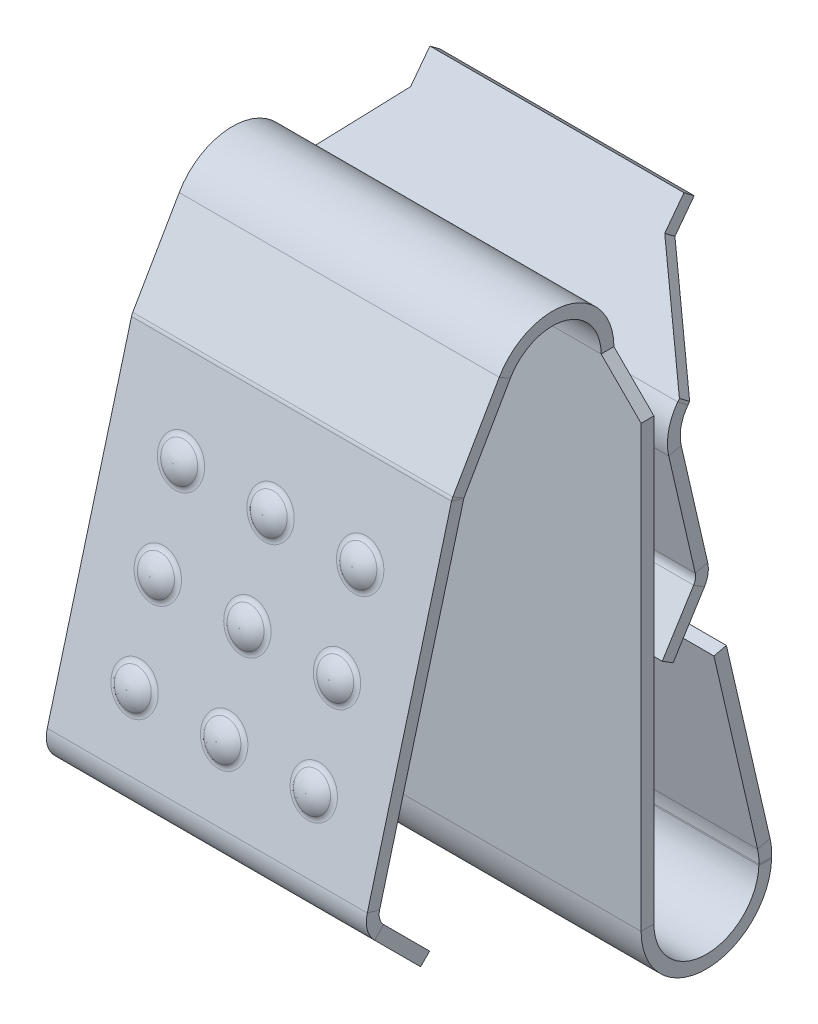
from build123d import *

# Parameters (mm, degrees)
SKETCH7_W              = 7.9375
SKETCH7_H              = 9.524915418
BASE_FLANGE1_DEPTH     = 0.254
EDGE_FLANGE1_DEPTH     = 6.35
CHAMFER1_SIZE          = 0.79375
EDGE_FLANGE2_START     = -3.175
EDGE_FLANGE2_DEPTH     = 6.35
EDGE_FLANGE3_DEPTH     = 6.35
CHAMFER2_SIZE          = 0.762
EDGE_FLANGE4_DEPTH     = 7.9375
EDGE_FLANGE5_DEPTH     = 7.9375
EDGE_FLANGE6_START     = -3.96875
EDGE_FLANGE6_DEPTH     = 7.9375
CHAMFER3_SIZE          = 1.4478
CHAMFER3_SIZE2         = 1.921295493
SKETCH30_W             = 5.0419
SKETCH30_H             = 0.635
TAB1_DEPTH             = 0.254
SKETCH33_W             = 1.651
SKETCH33_H             = 1.650807976
CUT_EXTRUDE1_DEPTH     = 0.254
EDGE_FLANGE7_DEPTH     = 1.524
SKETCH37_R             = 0.3937
BOSS_EXTRUDE1_DEPTH    = 0.166878
FILLET1_R              = 0.530606
FILLET2_R              = 0.1524
LPATTERN1_COUNT        = 3
LPATTERN1_PITCH        = 1.778
LPATTERN1_COUNT_DIR2   = 3
LPATTERN1_PITCH_DIR2   = 1.778
FILLET1_OF_LPATTERN1_R = 0.530606
FILLET2_OF_LPATTERN1_R = 0.1524


# Read off the part's stored shape, not the designer's step: Edge-Flange2, Edge-Flange6, SurfaceCut1
# Sheet-metal steps are written as plain solids
# Some blends are built 0.0001 mm under size
with BuildPart() as part:
    # Sketch7 → Base-Flange1 (new body)
    with BuildSketch(Plane.XY):
        with Locations((0, 4.762457709)):
            Rectangle(SKETCH7_W, SKETCH7_H)
    extrude(amount=-BASE_FLANGE1_DEPTH)

    # Edge-Flange1 section (across the edge) → Edge-Flange1 (add)
    with BuildSketch(Plane(origin=(3.175, 13.127090857, 0), x_dir=(0, -0.500000000000001, -0.866025403784438), z_dir=(-1, 0, 0))):
        with BuildLine():
            Line((-0.254, 3.602175439), (-0.254, 5.444797135))
            Line((-0.254, 5.444797135), (0, 5.444797135))
            Line((0, 5.444797135), (0, 3.602175439))
            ThreePointArc((0, 3.602175439), (0.715387858, 2.669863832), (1.80108772, 3.119575439))
            Line((1.80108772, 3.119575439), (2.021058172, 2.992575439))
            ThreePointArc((2.021058172, 2.992575439), (0.64964782, 2.424518672), (-0.254, 3.602175439))
        make_face()
    extrude(amount=EDGE_FLANGE1_DEPTH)

    # Chamfer1
    chamfer1_edges = [part.edges().sort_by_distance(p)[0] for p in [
        (-3.96875, 9.524915418, -0.127),
        (3.96875, 9.524915418, -0.127),
    ]]
    chamfer(chamfer1_edges, length=CHAMFER1_SIZE - 0.0001)  # a hair under: the kernel refuses the full size

    # Edge-Flange2 outline → Edge-Flange2 (add)
    with BuildSketch(Plane.YZ.offset(EDGE_FLANGE2_START)):
        with BuildLine():
            Line((8.41175822, 2.722398567), (8.53875822, 2.94236902))
            ThreePointArc((8.53875822, 2.94236902), (8.508959812, 2.957063969), (8.477498258, 2.967743727))
            Line((8.477498258, 2.967743727), (2.238776274, 4.639404245))
            Line((2.238776274, 4.639404245), (2.173036237, 4.394059085))
            Line((2.173036237, 4.394059085), (8.41175822, 2.722398567))
        make_face()
    extrude(amount=EDGE_FLANGE2_DEPTH)

    # Edge-Flange3 section (across the edge) → Edge-Flange3 (add)
    with BuildSketch(Plane(origin=(3.175, 2.003056124, 4.439605119), x_dir=(0, 0.7071067811865389, -0.7071067811865563), z_dir=(-1, 0, 0))):
        with BuildLine():
            Line((-0.254, 0.175976362), (-0.254, 2.229269032))
            Line((-0.254, 2.229269032), (0, 2.229269032))
            Line((0, 2.229269032), (0, 0.175976362))
            ThreePointArc((0, 0.175976362), (0.040835457, 0.023576362), (0.1524, -0.087988181))
            Line((0.1524, -0.087988181), (0.0254, -0.307958634))
            ThreePointArc((0.0254, -0.307958634), (-0.179134996, -0.103423638), (-0.254, 0.175976362))
        make_face()
    extrude(amount=EDGE_FLANGE3_DEPTH)

    # Chamfer2
    chamfer2_edges = [part.edges().sort_by_distance(p)[0] for p in [
        (3.175, 0.336922313, 2.953076431),
        (-3.175, 0.336922313, 2.953076431),
    ]]
    chamfer(chamfer2_edges, length=CHAMFER2_SIZE)

    # Edge-Flange4 section (across the edge) → Edge-Flange4 (add)
    with BuildSketch(Plane(origin=(3.96875, -59.661766042, -0.254), x_dir=(0, 0.03489949670250102, 0.9993908270190958), z_dir=(-1, 0, 0))):
        with BuildLine():
            Line((-0.254, 59.661766042), (-0.254, 59.687166042))
            Line((-0.254, 59.687166042), (0, 59.687166042))
            Line((0, 59.687166042), (0, 59.661766042))
            ThreePointArc((0, 59.661766042), (1.023225064, 58.620524653), (2.082165607, 59.625421706))
            Line((2.082165607, 59.625421706), (2.336010877, 59.616557234))
            ThreePointArc((2.336010877, 59.616557234), (1.018792153, 58.366563338), (-0.254, 59.661766042))
        make_face()
    extrude(amount=EDGE_FLANGE4_DEPTH)

    # Edge-Flange5 section (across the edge) → Edge-Flange5 (add)
    with BuildSketch(Plane(origin=(3.96875, 0.126059583, -2.341836877), x_dir=(0, -0.2249510543438583, 0.9743700647852369), z_dir=(-1, 0, 0))):
        with BuildLine():
            Line((-0.254, 0.137102911), (-0.254, 7.973148266))
            Line((-0.254, 7.973148266), (0, 7.973148266))
            Line((0, 7.973148266), (0, 0.137102911))
            ThreePointArc((0, 0.137102911), (0.008909321, 0.001172934), (0.035484845, -0.132431243))
            Line((0.035484845, -0.132431243), (-0.209860315, -0.19817128))
            ThreePointArc((-0.209860315, -0.19817128), (-0.242917673, -0.031980718), (-0.254, 0.137102911))
        make_face()
    extrude(amount=EDGE_FLANGE5_DEPTH)

    # Edge-Flange6 outline → Edge-Flange6 (add)
    with BuildSketch(Plane.YZ.offset(EDGE_FLANGE6_START)):
        with BuildLine():
            Line((10.313206583, -1.916191386), (8.73485091, -0.726815076))
            ThreePointArc((8.73485091, -0.726815076), (8.334645124, -0.544430792), (7.894856575, -0.548268768))
            Line((7.894856575, -0.548268768), (7.951994143, -0.795758765))
            ThreePointArc((7.951994143, -0.795758765), (8.281835555, -0.792880282), (8.581989894, -0.929668495))
            Line((8.581989894, -0.929668495), (10.160345567, -2.119044805))
            Line((10.160345567, -2.119044805), (10.313206583, -1.916191386))
        make_face()
    extrude(amount=EDGE_FLANGE6_DEPTH)

    # Chamfer3
    chamfer3_edges = [part.edges().sort_by_distance(p)[0] for p in [
        (-3.96875, 10.236776075, -2.017618096),
        (3.96875, 10.236776075, -2.017618096),
    ]]
    chamfer3_side = [part.faces().sort_by_distance(p)[0] for p in [
        (0, 10.236776075, -2.017618096),
    ]]
    chamfer(chamfer3_edges, length=CHAMFER3_SIZE, length2=CHAMFER3_SIZE2, reference=chamfer3_side[0])

    # Sketch30 → Tab1 (add)
    with BuildSketch(Plane(origin=(0, 2.814270104, 3.734662569), x_dir=(1, 0, 0), z_dir=(0, 0.6018150231520505, 0.7986355100472912))):
        with Locations((0, 9.707185762)):
            Rectangle(SKETCH30_W, SKETCH30_H)
    extrude(amount=-TAB1_DEPTH)

    # Sketch33 → Cut-Extrude1 (cut)
    with BuildSketch(Plane(origin=(0, 0.576813417, -2.498453398), x_dir=(-1, 0, 0), z_dir=(0, 0.2249510543438583, -0.9743700647852369))):
        with Locations((-3.14325, 4.408673174)):
            Rectangle(SKETCH33_W, SKETCH33_H)
    cut_extrude1 = extrude(amount=-CUT_EXTRUDE1_DEPTH, mode=Mode.SUBTRACT)

    # Edge-Flange7 section (across the edge) → Edge-Flange7 (add)
    with BuildSketch(Plane(origin=(2.44475, 5.517090239, -1.097219381), x_dir=(-1.6147430075010574e-15, 0.5299192642332057, 0.8480480961564255), z_dir=(1, 0, 0))):
        with BuildLine():
            Line((-0.254, 0.105210245), (-0.254, 1.279089755))
            Line((-0.254, 1.279089755), (0, 1.279089755))
            Line((0, 1.279089755), (0, 0.105210245))
            ThreePointArc((0, 0.105210245), (0.019334599, 0.008008653), (0.074394878, -0.074394878))
            Line((0.074394878, -0.074394878), (-0.105210245, -0.254))
            ThreePointArc((-0.105210245, -0.254), (-0.215330803, -0.089192939), (-0.254, 0.105210245))
        make_face()
    edge_flange7 = extrude(amount=EDGE_FLANGE7_DEPTH)

    # Mirror1: Cut-Extrude1, Edge-Flange7 across plane
    add(cut_extrude1.mirror(Plane(origin=(0, 0, 0), x_dir=(0, 0, 1), z_dir=(1, 0, 0))), mode=Mode.SUBTRACT)
    add(edge_flange7.mirror(Plane(origin=(0, 0, 0), x_dir=(0, 0, 1), z_dir=(1, 0, 0))))

    # Sketch37 → Boss-Extrude1 (add)
    with BuildSketch(Plane(origin=(0, 1.309820635, 4.888317158), x_dir=(1, 0, 0), z_dir=(0, 0.2588190451025286, 0.9659258262890663))):
        with Locations(Location((-1.77165, 5.790807795, 0), (0, 0, 90))):
            Circle(SKETCH37_R)
    boss_extrude1 = extrude(amount=BOSS_EXTRUDE1_DEPTH)

    # Fillet1
    # the kernel refuses this fillet: 0.530606 mm, written as the material it takes off along each edge
    with BuildSketch(Plane(origin=(-1.77165, 6.946502644, 3.550737584), x_dir=(0, 0.9659258262890662, -0.2588190451025287), z_dir=(1, 0, 0))) as fillet1_piece_1:
        with BuildLine():
            CenterArc((0.007378024, -0.530606), FILLET1_R, 43.274584136, 46.725415864)
            Line((0.007378024, 0), (0.007378024, 0.01061212))
            Line((0.007378024, 0.01061212), (0.3937, 0.01061212))
            Line((0.3937, 0.01061212), (0.40431212, 0))
            ThreePointArc((0.40431212, 0), (0.40431212, -0.083439), (0.40142644, -0.15960344))
            Line((0.40142644, -0.15960344), (0.3937, -0.166878))
        make_face()
    revolve(axis=Axis((-1.77165, 6.946502644, 3.550737584), (0, 0.2588190451025286, 0.9659258262890663)), mode=Mode.SUBTRACT)

    # Fillet2
    fillet2_edges = [part.edges().sort_by_distance(p)[0] for p in [
        (-1.77165, 6.523026441, 3.491442872),
    ]]
    fillet(fillet2_edges, radius=FILLET2_R)

    # SurfaceCut1 outline → SurfaceCut1 (revolve, cut)
    with BuildSketch(Plane(origin=(-1.77165, 5.593490804, -1.498771344), x_dir=(1, 0, 0), z_dir=(0, -0.9659258262890661, 0.25881904510252907))):
        with BuildLine():
            Line((0, 4.806758316), (0.454713562, 4.806758316))
            ThreePointArc((0.454713562, 4.806758316), (0.312668551, 4.832390441), (0.188541431, 4.906053519))
            ThreePointArc((0.188541431, 4.906053519), (0.10405741, 4.956190451), (0.007378024, 4.973636316))
            Line((0.007378024, 4.973636316), (0, 4.973636316))
            Line((0, 4.973636316), (0, 4.806758316))
        make_face()
    surfacecut1 = revolve(axis=Axis((-1.77165, 5.593490804, -1.498771344), (0, 0.25881904510252907, 0.9659258262890661)), mode=Mode.SUBTRACT)

    # LPattern1: Boss-Extrude1, SurfaceCut1 3 × 3
    with Locations(*[Vector(1, 0, 0) * (i * LPATTERN1_PITCH) + Vector(0, -0.9659258262890662, 0.25881904510252857) * (j * LPATTERN1_PITCH_DIR2) for i in range(LPATTERN1_COUNT) for j in range(LPATTERN1_COUNT_DIR2) if (i, j) != (0, 0)]):
        add(boss_extrude1)
        add(surfacecut1, mode=Mode.SUBTRACT)

    # Fillet1 of LPattern1
    # the kernel refuses this fillet: 0.530606 mm, written as the material it takes off along each edge
    with BuildSketch(Plane(origin=(-1.77165, 5.229086525, 4.010917846), x_dir=(0, 0.9659258262890665, -0.25881904510252707), z_dir=(1, 0, 0))) as fillet1_of_lpattern1_piece_1:
        with BuildLine():
            CenterArc((0.007378024, -0.530606), FILLET1_OF_LPATTERN1_R, 43.274584136, 46.725415864)
            Line((0.007378024, 0), (0.007378024, 0.01061212))
            Line((0.007378024, 0.01061212), (0.3937, 0.01061212))
            Line((0.3937, 0.01061212), (0.40431212, 0))
            ThreePointArc((0.40431212, 0), (0.40431212, -0.083439), (0.40142644, -0.15960344))
            Line((0.40142644, -0.15960344), (0.3937, -0.166878))
        make_face()
    revolve(axis=Axis((-1.77165, 5.229086525, 4.010917846), (0, 0.2588190451025286, 0.9659258262890663)), mode=Mode.SUBTRACT)
    with BuildSketch(Plane(origin=(-1.77165, 3.511670405, 4.471098109), x_dir=(0, 0.9659258262890665, -0.2588190451025276), z_dir=(1, 0, 0))) as fillet1_of_lpattern1_piece_2:
        with BuildLine():
            CenterArc((0.007378024, -0.530606), FILLET1_OF_LPATTERN1_R, 43.274584136, 46.725415864)
            Line((0.007378024, 0), (0.007378024, 0.01061212))
            Line((0.007378024, 0.01061212), (0.3937, 0.01061212))
            Line((0.3937, 0.01061212), (0.40431212, 0))
            ThreePointArc((0.40431212, 0), (0.40431212, -0.083439), (0.40142644, -0.15960344))
            Line((0.40142644, -0.15960344), (0.3937, -0.166878))
        make_face()
    revolve(axis=Axis((-1.77165, 3.511670405, 4.471098109), (0, 0.2588190451025286, 0.9659258262890663)), mode=Mode.SUBTRACT)
    with BuildSketch(Plane(origin=(0.00635, 6.946502644, 3.550737584), x_dir=(0, 0.9659258262890662, -0.2588190451025287), z_dir=(1, 0, 0))) as fillet1_of_lpattern1_piece_3:
        with BuildLine():
            CenterArc((0.007378024, -0.530606), FILLET1_OF_LPATTERN1_R, 43.274584136, 46.725415864)
            Line((0.007378024, 0), (0.007378024, 0.01061212))
            Line((0.007378024, 0.01061212), (0.3937, 0.01061212))
            Line((0.3937, 0.01061212), (0.40431212, 0))
            ThreePointArc((0.40431212, 0), (0.40431212, -0.083439), (0.40142644, -0.15960344))
            Line((0.40142644, -0.15960344), (0.3937, -0.166878))
        make_face()
    revolve(axis=Axis((0.00635, 6.946502644, 3.550737584), (0, 0.2588190451025286, 0.9659258262890663)), mode=Mode.SUBTRACT)
    with BuildSketch(Plane(origin=(0.00635, 5.229086525, 4.010917846), x_dir=(0, 0.9659258262890656, -0.2588190451025303), z_dir=(1, 0, 0))) as fillet1_of_lpattern1_piece_4:
        with BuildLine():
            CenterArc((0.007378024, -0.530606), FILLET1_OF_LPATTERN1_R, 43.274584136, 46.725415864)
            Line((0.007378024, 0), (0.007378024, 0.01061212))
            Line((0.007378024, 0.01061212), (0.3937, 0.01061212))
            Line((0.3937, 0.01061212), (0.40431212, 0))
            ThreePointArc((0.40431212, 0), (0.40431212, -0.083439), (0.40142644, -0.15960344))
            Line((0.40142644, -0.15960344), (0.3937, -0.166878))
        make_face()
    revolve(axis=Axis((0.00635, 5.229086525, 4.010917846), (0, 0.2588190451025286, 0.9659258262890663)), mode=Mode.SUBTRACT)
    with BuildSketch(Plane(origin=(0.00635, 3.511670405, 4.471098109), x_dir=(0, 0.9659258262890659, -0.25881904510252973), z_dir=(1, 0, 0))) as fillet1_of_lpattern1_piece_5:
        with BuildLine():
            CenterArc((0.007378024, -0.530606), FILLET1_OF_LPATTERN1_R, 43.274584136, 46.725415864)
            Line((0.007378024, 0), (0.007378024, 0.01061212))
            Line((0.007378024, 0.01061212), (0.3937, 0.01061212))
            Line((0.3937, 0.01061212), (0.40431212, 0))
            ThreePointArc((0.40431212, 0), (0.40431212, -0.083439), (0.40142644, -0.15960344))
            Line((0.40142644, -0.15960344), (0.3937, -0.166878))
        make_face()
    revolve(axis=Axis((0.00635, 3.511670405, 4.471098109), (0, 0.2588190451025286, 0.9659258262890663)), mode=Mode.SUBTRACT)
    with BuildSketch(Plane(origin=(1.78435, 6.946502644, 3.550737584), x_dir=(0, 0.9659258262890662, -0.2588190451025287), z_dir=(1, 0, 0))) as fillet1_of_lpattern1_piece_6:
        with BuildLine():
            CenterArc((0.007378024, -0.530606), FILLET1_OF_LPATTERN1_R, 43.274584136, 46.725415864)
            Line((0.007378024, 0), (0.007378024, 0.01061212))
            Line((0.007378024, 0.01061212), (0.3937, 0.01061212))
            Line((0.3937, 0.01061212), (0.40431212, 0))
            ThreePointArc((0.40431212, 0), (0.40431212, -0.083439), (0.40142644, -0.15960344))
            Line((0.40142644, -0.15960344), (0.3937, -0.166878))
        make_face()
    revolve(axis=Axis((1.78435, 6.946502644, 3.550737584), (0, 0.2588190451025286, 0.9659258262890663)), mode=Mode.SUBTRACT)
    with BuildSketch(Plane(origin=(1.78435, 5.229086525, 4.010917846), x_dir=(0, 0.965925826289066, -0.2588190451025292), z_dir=(1, 0, 0))) as fillet1_of_lpattern1_piece_7:
        with BuildLine():
            CenterArc((0.007378024, -0.530606), FILLET1_OF_LPATTERN1_R, 43.274584136, 46.725415864)
            Line((0.007378024, 0), (0.007378024, 0.01061212))
            Line((0.007378024, 0.01061212), (0.3937, 0.01061212))
            Line((0.3937, 0.01061212), (0.40431212, 0))
            ThreePointArc((0.40431212, 0), (0.40431212, -0.083439), (0.40142644, -0.15960344))
            Line((0.40142644, -0.15960344), (0.3937, -0.166878))
        make_face()
    revolve(axis=Axis((1.78435, 5.229086525, 4.010917846), (0, 0.2588190451025286, 0.9659258262890663)), mode=Mode.SUBTRACT)
    with BuildSketch(Plane(origin=(1.78435, 3.511670405, 4.471098109), x_dir=(0, 0.9659258262890659, -0.25881904510252973), z_dir=(1, 0, 0))) as fillet1_of_lpattern1_piece_8:
        with BuildLine():
            CenterArc((0.007378024, -0.530606), FILLET1_OF_LPATTERN1_R, 43.274584136, 46.725415864)
            Line((0.007378024, 0), (0.007378024, 0.01061212))
            Line((0.007378024, 0.01061212), (0.3937, 0.01061212))
            Line((0.3937, 0.01061212), (0.40431212, 0))
            ThreePointArc((0.40431212, 0), (0.40431212, -0.083439), (0.40142644, -0.15960344))
            Line((0.40142644, -0.15960344), (0.3937, -0.166878))
        make_face()
    revolve(axis=Axis((1.78435, 3.511670405, 4.471098109), (0, 0.2588190451025286, 0.9659258262890663)), mode=Mode.SUBTRACT)

    # Fillet2 of LPattern1
    fillet2_of_lpattern1_edges = [part.edges().sort_by_distance(p)[0] for p in [
        (-1.77165, 4.805610322, 3.951623134),
        (-1.77165, 3.088194203, 4.411803397),
        (0.00635, 6.523026441, 3.491442872),
        (0.00635, 4.805610322, 3.951623134),
        (0.00635, 3.088194203, 4.411803397),
        (1.78435, 6.523026441, 3.491442872),
        (1.78435, 4.805610322, 3.951623134),
        (1.78435, 3.088194203, 4.411803397),
    ]]
    fillet(fillet2_of_lpattern1_edges, radius=FILLET2_OF_LPATTERN1_R)


solid = part.part
